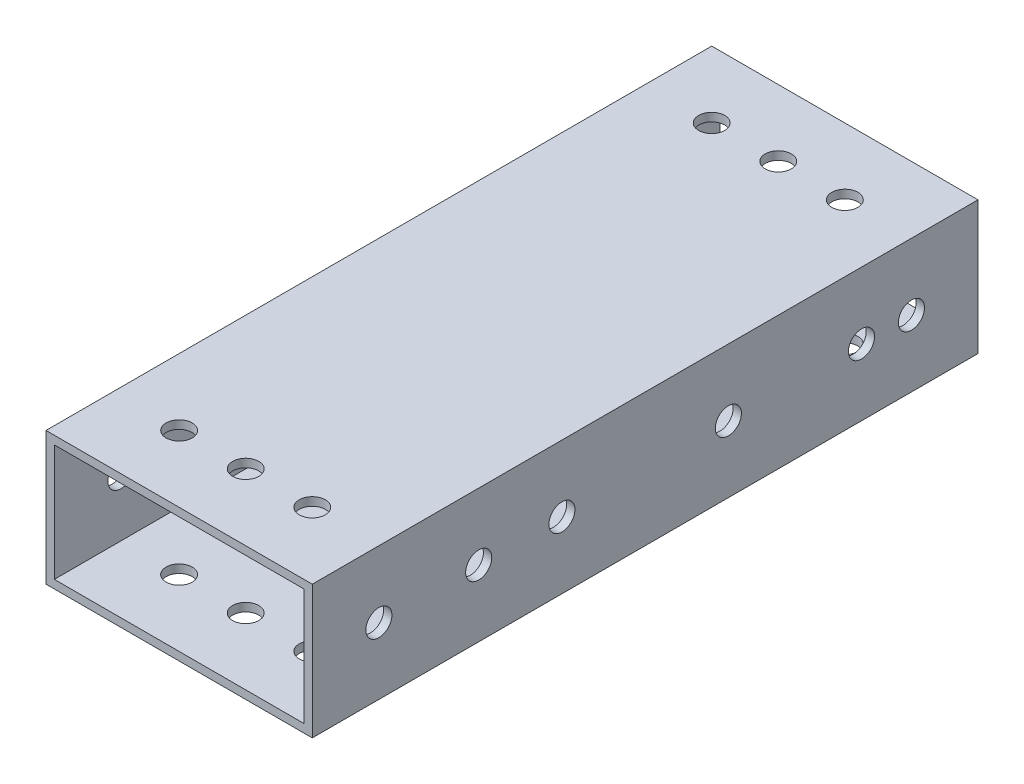
from build123d import *

# Parameters (mm, degrees)
SKETCH1_W           = 50.8
SKETCH1_H           = 25.4
SKETCH1_W_2         = 47.625
SKETCH1_H_2         = 22.225
BOSS_EXTRUDE1_DEPTH = 63.5
SKETCH2_R           = 2.4892
CUT_EXTRUDE1_DEPTH  = 73.955945611
SKETCH3_R           = 2.4892
CUT_EXTRUDE2_DEPTH  = 83.30540687


with BuildPart() as part:
    # Sketch1 → Boss-Extrude1 (new, symmetric)
    with BuildSketch(Plane.XY):
        Rectangle(SKETCH1_W, SKETCH1_H)
        Rectangle(SKETCH1_W_2, SKETCH1_H_2, mode=Mode.SUBTRACT)
    extrude(amount=BOSS_EXTRUDE1_DEPTH, both=True)

    # Sketch2 → Cut-Extrude1 (cut, through all)
    with BuildSketch(Plane(origin=(0, 12.7, 0), x_dir=(1, 0, 0), z_dir=(0, 1, 0))):
        with Locations((-12.7, 50.8)):
            Circle(SKETCH2_R)
        with Locations((0, 50.8)):
            Circle(SKETCH2_R)
        with Locations((12.7, 50.8)):
            Circle(SKETCH2_R)
        with Locations((12.7, -50.8)):
            Circle(SKETCH2_R)
        with Locations((0, -50.8)):
            Circle(SKETCH2_R)
        with Locations((-12.7, -50.8)):
            Circle(SKETCH2_R)
    extrude(amount=-CUT_EXTRUDE1_DEPTH, mode=Mode.SUBTRACT)

    # Sketch3 → Cut-Extrude2 (cut, through all)
    with BuildSketch(Plane(origin=(25.4, 0, 0), x_dir=(0, 0, -1), z_dir=(1, 0, 0))):
        with Locations((50.8, 0)):
            Circle(SKETCH3_R)
        with Locations((41.275, 0)):
            Circle(SKETCH3_R)
        with Locations((15.875, 0)):
            Circle(SKETCH3_R)
        with Locations((-50.8, 0)):
            Circle(SKETCH3_R)
        with Locations((-31.75, 0)):
            Circle(SKETCH3_R)
        with Locations((-15.875, 0)):
            Circle(SKETCH3_R)
    extrude(amount=-CUT_EXTRUDE2_DEPTH, mode=Mode.SUBTRACT)


solid = part.part
